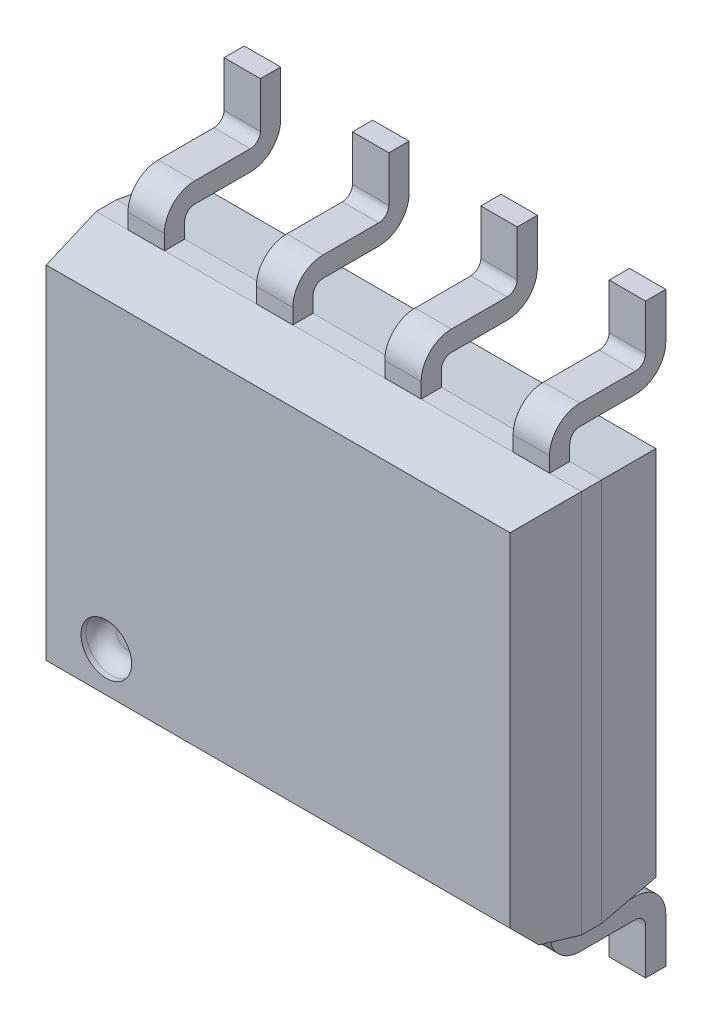
from build123d import *

# Parameters (mm, degrees)
SZKIC1_W                   = 2.4
SZKIC1_H                   = 1.9
WYCI_GNI_CIE1_DEPTH        = 1.75
SZKIC2_W                   = 2.4
SZKIC2_H                   = 1.75
WYCI_GNI_CIE2_DEPTH        = 1.9
SZKIC3_W                   = 1.75
SZKIC3_H                   = 3.8
WYCI_GNI_CIE3_DEPTH        = 2.4
SFAZOWANIE1_SIZE           = 0.6
SFAZOWANIE1_SIZE2          = 0.105796188
SFAZOWANIE3_SIZE           = 0.2
SFAZOWANIE3_SIZE2          = 0.24656061
SFAZOWANIE4_SIZE           = 0.6
SFAZOWANIE4_SIZE2          = 0.105796188
SZKIC4_W                   = 0.36
SZKIC4_H                   = 0.2
WYCI_GNI_CIE4_DEPTH        = 0.45
SZKIC6_W                   = 0.36
SZKIC6_H                   = 0.2
WYCI_GNI_CIE5_DEPTH        = 0.95
SZKIC10_W                  = 0.36
SZKIC10_H                  = 0.2
WYCI_GNI_CIE6_DEPTH        = 0.45
SZKIC11_W                  = 0.36
SZKIC11_H                  = 0.2
WYCI_GNI_CIE7_DEPTH        = 0.95
SZKIC12_W                  = 4.8
SZKIC12_H                  = 3.8
WYTNIJ_WYCI_GNI_CIE3_DEPTH = 0.35
SFAZOWANIE6_SIZE           = 0.6
SFAZOWANIE6_SIZE_2         = 0.063062541
SFAZOWANIE7_SIZE           = 0.6
SFAZOWANIE7_SIZE2          = 0.063062541
SFAZOWANIE8_SIZE           = 0.6
SFAZOWANIE8_SIZE_2         = 0.063062541
SFAZOWANIE9_SIZE           = 0.6
SFAZOWANIE9_SIZE2          = 0.063062541
SFAZOWANIE10_SIZE          = 0.6
SFAZOWANIE10_SIZE2         = 0.105796188
SFAZOWANIE11_SIZE          = 0.6
SFAZOWANIE11_SIZE2         = 0.105796188
SZKIC13_W                  = 0.36
SZKIC13_H                  = 0.2
WYCI_GNI_CIE8_DEPTH        = 0.55
SZKIC14_W                  = 0.36
SZKIC14_H                  = 0.2
WYCI_GNI_CIE9_DEPTH        = 0.55
ZAOKR_GLENIE1_R            = 0.3
ZAOKR_GLENIE2_R            = 0.3
ZAOKR_GLENIE3_R            = 0.3
ZAOKR_GLENIE4_R            = 0.3
ZAOKR_GLENIE5_R            = 0.1
ZAOKR_GLENIE6_R            = 0.3
ZAOKR_GLENIE7_R            = 0.3
ZAOKR_GLENIE8_R            = 0.3
ZAOKR_GLENIE9_R            = 0.3
ZAOKR_GLENIE10_R           = 0.3
ZAOKR_GLENIE11_R           = 0.3
ZAOKR_GLENIE12_R           = 0.3
ZAOKR_GLENIE13_R           = 0.3
ZAOKR_GLENIE14_R           = 0.3
ZAOKR_GLENIE15_R           = 0.3
ZAOKR_GLENIE16_R           = 0.3
ZAOKR_GLENIE17_R           = 0.3
ZAOKR_GLENIE18_R           = 0.1
ZAOKR_GLENIE19_R           = 0.1
ZAOKR_GLENIE20_R           = 0.1
ZAOKR_GLENIE21_R           = 0.1
ZAOKR_GLENIE22_R           = 0.1
ZAOKR_GLENIE23_R           = 0.1
ZAOKR_GLENIE24_R           = 0.1
ZAOKR_GLENIE25_R           = 0.1
ZAOKR_GLENIE26_R           = 0.1
ZAOKR_GLENIE27_R           = 0.1
ZAOKR_GLENIE28_R           = 0.1
ZAOKR_GLENIE29_R           = 0.1
ZAOKR_GLENIE30_R           = 0.1
ZAOKR_GLENIE31_R           = 0.1
ZAOKR_GLENIE32_R           = 0.1
SZKIC15_R                  = 0.25
WYTNIJ_WYCI_GNI_CIE4_DEPTH = 0.2
ZAOKR_GLENIE33_R           = 0.15


with BuildPart() as part:
    # Szkic1 → Wyciągnięcie1 (new body)
    with BuildSketch(Plane.XY):
        with Locations((1.2, 0.95)):
            Rectangle(SZKIC1_W, SZKIC1_H)
    extrude(amount=WYCI_GNI_CIE1_DEPTH)

    # Szkic2 → Wyciągnięcie2 (add)
    with BuildSketch(Plane.XZ):
        with Locations((1.2, 0.875)):
            Rectangle(SZKIC2_W, SZKIC2_H)
    extrude(amount=WYCI_GNI_CIE2_DEPTH)

    # Szkic3 → Wyciągnięcie3 (add)
    with BuildSketch(Plane.ZY):
        with Locations((0.875, 0)):
            Rectangle(SZKIC3_W, SZKIC3_H)
    extrude(amount=WYCI_GNI_CIE3_DEPTH)

    # Sfazowanie1
    sfazowanie1_edges = [part.edges().sort_by_distance(p)[0] for p in [
        (0, -1.9, 1.75),
    ]]
    sfazowanie1_side = [part.faces().sort_by_distance(p)[0] for p in [
        (0, -1.9, 0.875),
    ]]
    chamfer(sfazowanie1_edges, length=SFAZOWANIE1_SIZE, length2=SFAZOWANIE1_SIZE2, reference=sfazowanie1_side[0])

    # Sfazowanie3
    sfazowanie3_edges = [part.edges().sort_by_distance(p)[0] for p in [
        (0, -1.794203812, 1.75),
    ]]
    sfazowanie3_side = [part.faces().sort_by_distance(p)[0] for p in [
        (0, 0.052898094, 1.75),
    ]]
    chamfer(sfazowanie3_edges, length=SFAZOWANIE3_SIZE, length2=SFAZOWANIE3_SIZE2, reference=sfazowanie3_side[0])

    # Sfazowanie4
    sfazowanie4_edges = [part.edges().sort_by_distance(p)[0] for p in [
        (0, 1.9, 1.75),
    ]]
    sfazowanie4_side = [part.faces().sort_by_distance(p)[0] for p in [
        (0, 1.9, 0.875),
    ]]
    chamfer(sfazowanie4_edges, length=SFAZOWANIE4_SIZE, length2=SFAZOWANIE4_SIZE2, reference=sfazowanie4_side[0])

    # Szkic4 → Wyciągnięcie4 (add)
    with BuildSketch(Plane.XZ.offset(1.9)):
        with Locations((-1.905, 1.05)):
            Rectangle(SZKIC4_W, SZKIC4_H)
        with Locations((-0.635, 1.05)):
            Rectangle(SZKIC4_W, SZKIC4_H)
        with Locations((0.635, 1.05)):
            Rectangle(SZKIC4_W, SZKIC4_H)
        with Locations((1.905, 1.05)):
            Rectangle(SZKIC4_W, SZKIC4_H)
    extrude(amount=WYCI_GNI_CIE4_DEPTH)

    # Szkic6 → Wyciągnięcie5 (add)
    with BuildSketch(Plane(origin=(0, 0, 0.95), x_dir=(-1, 0, 0), z_dir=(0, 0, -1))):
        with Locations((-1.905, -2.25)):
            Rectangle(SZKIC6_W, SZKIC6_H)
        with Locations((-0.635, -2.25)):
            Rectangle(SZKIC6_W, SZKIC6_H)
        with Locations((0.635, -2.25)):
            Rectangle(SZKIC6_W, SZKIC6_H)
        with Locations((1.905, -2.25)):
            Rectangle(SZKIC6_W, SZKIC6_H)
    extrude(amount=WYCI_GNI_CIE5_DEPTH)

    # Szkic10 → Wyciągnięcie6 (add)
    with BuildSketch(Plane(origin=(0, 1.9, 0), x_dir=(-1, 0, 0), z_dir=(0, 1, 0))):
        with Locations((1.905, 1.05)):
            Rectangle(SZKIC10_W, SZKIC10_H)
        with Locations((0.635, 1.05)):
            Rectangle(SZKIC10_W, SZKIC10_H)
        with Locations((-0.635, 1.05)):
            Rectangle(SZKIC10_W, SZKIC10_H)
        with Locations((-1.905, 1.05)):
            Rectangle(SZKIC10_W, SZKIC10_H)
    extrude(amount=WYCI_GNI_CIE6_DEPTH)

    # Szkic11 → Wyciągnięcie7 (add)
    with BuildSketch(Plane(origin=(0, 0, 0.95), x_dir=(-1, 0, 0), z_dir=(0, 0, -1))):
        with Locations((-1.905, 2.25)):
            Rectangle(SZKIC11_W, SZKIC11_H)
        with Locations((-0.635, 2.25)):
            Rectangle(SZKIC11_W, SZKIC11_H)
        with Locations((0.635, 2.25)):
            Rectangle(SZKIC11_W, SZKIC11_H)
        with Locations((1.905, 2.25)):
            Rectangle(SZKIC11_W, SZKIC11_H)
    extrude(amount=WYCI_GNI_CIE7_DEPTH)

    # Szkic12 → Wytnij-wyciągnięcie3 (cut)
    with BuildSketch(Plane(origin=(0, 0, 0), x_dir=(-1, 0, 0), z_dir=(0, 0, -1))):
        Rectangle(SZKIC12_W, SZKIC12_H)
    extrude(amount=-WYTNIJ_WYCI_GNI_CIE3_DEPTH, mode=Mode.SUBTRACT)

    # Sfazowanie6
    # the kernel refuses this chamfer: 0.6, 0.063062541 mm, written as the material it takes off along each edge
    with BuildSketch(Plane(origin=(-3.959683923, -1.9, 0.35), x_dir=(0, -0.00402114024619829, 0.999991915182878), z_dir=(1, 0, 0))) as sfazowanie6_piece_1:
        Polygon((SFAZOWANIE6_SIZE * 0.999991915183, -SFAZOWANIE6_SIZE * 0.0040211402462), (-SFAZOWANIE6_SIZE_2 * 0.00402114025636, -SFAZOWANIE6_SIZE_2 * 0.999991917711), (0, 0), align=None)
    extrude(amount=7.919367847, mode=Mode.SUBTRACT)

    # Sfazowanie7
    sfazowanie7_edges = [part.edges().sort_by_distance(p)[0] for p in [
        (2.4, 0.031531271, 0.35),
    ]]
    sfazowanie7_side = [part.faces().sort_by_distance(p)[0] for p in [
        (2.4, 0.014931296, 1.042843103),
    ]]
    chamfer(sfazowanie7_edges, length=SFAZOWANIE7_SIZE, length2=SFAZOWANIE7_SIZE2, reference=sfazowanie7_side[0])

    # Sfazowanie8
    # the kernel refuses this chamfer: 0.6, 0.063062541 mm, written as the material it takes off along each edge
    with BuildSketch(Plane(origin=(3.896621382, 1.9, 0.35), x_dir=(0, 0.00402114024619829, 0.999991915182878), z_dir=(-1, 0, 0))) as sfazowanie8_piece_1:
        Polygon((SFAZOWANIE8_SIZE * 0.999991915183, -SFAZOWANIE8_SIZE * 0.0040211402462), (-SFAZOWANIE8_SIZE_2 * 0.00402114025636, -SFAZOWANIE8_SIZE_2 * 0.999991917711), (0, 0), align=None)
    extrude(amount=7.856305306, mode=Mode.SUBTRACT)

    # Sfazowanie9
    sfazowanie9_edges = [part.edges().sort_by_distance(p)[0] for p in [
        (-2.4, 0, 0.35),
    ]]
    sfazowanie9_side = [part.faces().sort_by_distance(p)[0] for p in [
        (-2.4, 0.008142166, 1.044638108),
    ]]
    chamfer(sfazowanie9_edges, length=SFAZOWANIE9_SIZE, length2=SFAZOWANIE9_SIZE2, reference=sfazowanie9_side[0])

    # Sfazowanie10
    sfazowanie10_edges = [part.edges().sort_by_distance(p)[0] for p in [
        (-2.4, 0.1, 1.75),
    ]]
    sfazowanie10_side = [part.faces().sort_by_distance(p)[0] for p in [
        (-2.4, 0.014325964, 1.343075486),
    ]]
    chamfer(sfazowanie10_edges, length=SFAZOWANIE10_SIZE, length2=SFAZOWANIE10_SIZE2, reference=sfazowanie10_side[0])

    # Sfazowanie11
    sfazowanie11_edges = [part.edges().sort_by_distance(p)[0] for p in [
        (2.4, 0.1, 1.75),
    ]]
    sfazowanie11_side = [part.faces().sort_by_distance(p)[0] for p in [
        (2.4, 0.014325964, 1.343075486),
    ]]
    chamfer(sfazowanie11_edges, length=SFAZOWANIE11_SIZE, length2=SFAZOWANIE11_SIZE2, reference=sfazowanie11_side[0])

    # Szkic13 → Wyciągnięcie8 (add)
    with BuildSketch(Plane(origin=(0, 2.35, 0), x_dir=(-1, 0, 0), z_dir=(0, 1, 0))):
        with Locations((1.905, 0.1)):
            Rectangle(SZKIC13_W, SZKIC13_H)
        with Locations((0.635, 0.1)):
            Rectangle(SZKIC13_W, SZKIC13_H)
        with Locations((-0.635, 0.1)):
            Rectangle(SZKIC13_W, SZKIC13_H)
        with Locations((-1.905, 0.1)):
            Rectangle(SZKIC13_W, SZKIC13_H)
    extrude(amount=WYCI_GNI_CIE8_DEPTH)

    # Szkic14 → Wyciągnięcie9 (add)
    with BuildSketch(Plane.XZ.offset(2.35)):
        with Locations((-1.905, 0.1)):
            Rectangle(SZKIC14_W, SZKIC14_H)
        with Locations((-0.635, 0.1)):
            Rectangle(SZKIC14_W, SZKIC14_H)
        with Locations((0.635, 0.1)):
            Rectangle(SZKIC14_W, SZKIC14_H)
        with Locations((1.905, 0.1)):
            Rectangle(SZKIC14_W, SZKIC14_H)
    extrude(amount=WYCI_GNI_CIE9_DEPTH)

    # Zaokrąglenie1
    zaokr_glenie1_edges = [part.edges().sort_by_distance(p)[0] for p in [
        (-1.905, -2.35, 1.15),
    ]]
    fillet(zaokr_glenie1_edges, radius=ZAOKR_GLENIE1_R)

    # Zaokrąglenie2
    zaokr_glenie2_edges = [part.edges().sort_by_distance(p)[0] for p in [
        (-0.635, -2.35, 1.15),
    ]]
    fillet(zaokr_glenie2_edges, radius=ZAOKR_GLENIE2_R)

    # Zaokrąglenie3
    zaokr_glenie3_edges = [part.edges().sort_by_distance(p)[0] for p in [
        (0.635, -2.35, 1.15),
    ]]
    fillet(zaokr_glenie3_edges, radius=ZAOKR_GLENIE3_R)

    # Zaokrąglenie4
    zaokr_glenie4_edges = [part.edges().sort_by_distance(p)[0] for p in [
        (1.905, -2.35, 1.15),
    ]]
    fillet(zaokr_glenie4_edges, radius=ZAOKR_GLENIE4_R)

    # Zaokrąglenie5
    zaokr_glenie5_edges = [part.edges().sort_by_distance(p)[0] for p in [
        (-1.905, -2.15, 0.95),
    ]]
    fillet(zaokr_glenie5_edges, radius=ZAOKR_GLENIE5_R)

    # Zaokrąglenie6
    zaokr_glenie6_edges = [part.edges().sort_by_distance(p)[0] for p in [
        (1.905, -2.15, 0),
    ]]
    fillet(zaokr_glenie6_edges, radius=ZAOKR_GLENIE6_R)

    # Zaokrąglenie7
    zaokr_glenie7_edges = [part.edges().sort_by_distance(p)[0] for p in [
        (0.635, -2.15, 0),
    ]]
    fillet(zaokr_glenie7_edges, radius=ZAOKR_GLENIE7_R)

    # Zaokrąglenie8
    zaokr_glenie8_edges = [part.edges().sort_by_distance(p)[0] for p in [
        (-0.635, -2.15, 0),
    ]]
    fillet(zaokr_glenie8_edges, radius=ZAOKR_GLENIE8_R)

    # Zaokrąglenie9
    zaokr_glenie9_edges = [part.edges().sort_by_distance(p)[0] for p in [
        (-1.905, -2.15, 0),
    ]]
    fillet(zaokr_glenie9_edges, radius=ZAOKR_GLENIE9_R)

    # Zaokrąglenie10
    zaokr_glenie10_edges = [part.edges().sort_by_distance(p)[0] for p in [
        (1.905, 2.35, 1.15),
    ]]
    fillet(zaokr_glenie10_edges, radius=ZAOKR_GLENIE10_R)

    # Zaokrąglenie11
    zaokr_glenie11_edges = [part.edges().sort_by_distance(p)[0] for p in [
        (0.635, 2.35, 1.15),
    ]]
    fillet(zaokr_glenie11_edges, radius=ZAOKR_GLENIE11_R)

    # Zaokrąglenie12
    zaokr_glenie12_edges = [part.edges().sort_by_distance(p)[0] for p in [
        (-0.635, 2.35, 1.15),
    ]]
    fillet(zaokr_glenie12_edges, radius=ZAOKR_GLENIE12_R)

    # Zaokrąglenie13
    zaokr_glenie13_edges = [part.edges().sort_by_distance(p)[0] for p in [
        (-1.905, 2.35, 1.15),
    ]]
    fillet(zaokr_glenie13_edges, radius=ZAOKR_GLENIE13_R)

    # Zaokrąglenie14
    zaokr_glenie14_edges = [part.edges().sort_by_distance(p)[0] for p in [
        (-1.905, 2.15, 0),
    ]]
    fillet(zaokr_glenie14_edges, radius=ZAOKR_GLENIE14_R)

    # Zaokrąglenie15
    zaokr_glenie15_edges = [part.edges().sort_by_distance(p)[0] for p in [
        (-0.635, 2.15, 0),
    ]]
    fillet(zaokr_glenie15_edges, radius=ZAOKR_GLENIE15_R)

    # Zaokrąglenie16
    zaokr_glenie16_edges = [part.edges().sort_by_distance(p)[0] for p in [
        (0.635, 2.15, 0),
    ]]
    fillet(zaokr_glenie16_edges, radius=ZAOKR_GLENIE16_R)

    # Zaokrąglenie17
    zaokr_glenie17_edges = [part.edges().sort_by_distance(p)[0] for p in [
        (1.905, 2.15, 0),
    ]]
    fillet(zaokr_glenie17_edges, radius=ZAOKR_GLENIE17_R)

    # Zaokrąglenie18
    zaokr_glenie18_edges = [part.edges().sort_by_distance(p)[0] for p in [
        (-1.905, -2.35, 0.2),
    ]]
    fillet(zaokr_glenie18_edges, radius=ZAOKR_GLENIE18_R)

    # Zaokrąglenie19
    zaokr_glenie19_edges = [part.edges().sort_by_distance(p)[0] for p in [
        (-0.635, -2.35, 0.2),
    ]]
    fillet(zaokr_glenie19_edges, radius=ZAOKR_GLENIE19_R)

    # Zaokrąglenie20
    zaokr_glenie20_edges = [part.edges().sort_by_distance(p)[0] for p in [
        (0.635, -2.35, 0.2),
    ]]
    fillet(zaokr_glenie20_edges, radius=ZAOKR_GLENIE20_R)

    # Zaokrąglenie21
    zaokr_glenie21_edges = [part.edges().sort_by_distance(p)[0] for p in [
        (1.905, -2.35, 0.2),
    ]]
    fillet(zaokr_glenie21_edges, radius=ZAOKR_GLENIE21_R)

    # Zaokrąglenie22
    zaokr_glenie22_edges = [part.edges().sort_by_distance(p)[0] for p in [
        (-0.635, -2.15, 0.95),
    ]]
    fillet(zaokr_glenie22_edges, radius=ZAOKR_GLENIE22_R)

    # Zaokrąglenie23
    zaokr_glenie23_edges = [part.edges().sort_by_distance(p)[0] for p in [
        (0.635, -2.15, 0.95),
    ]]
    fillet(zaokr_glenie23_edges, radius=ZAOKR_GLENIE23_R)

    # Zaokrąglenie24
    zaokr_glenie24_edges = [part.edges().sort_by_distance(p)[0] for p in [
        (1.905, -2.15, 0.95),
    ]]
    fillet(zaokr_glenie24_edges, radius=ZAOKR_GLENIE24_R)

    # Zaokrąglenie25
    zaokr_glenie25_edges = [part.edges().sort_by_distance(p)[0] for p in [
        (-1.905, 2.15, 0.95),
    ]]
    fillet(zaokr_glenie25_edges, radius=ZAOKR_GLENIE25_R)

    # Zaokrąglenie26
    zaokr_glenie26_edges = [part.edges().sort_by_distance(p)[0] for p in [
        (-0.635, 2.15, 0.95),
    ]]
    fillet(zaokr_glenie26_edges, radius=ZAOKR_GLENIE26_R)

    # Zaokrąglenie27
    zaokr_glenie27_edges = [part.edges().sort_by_distance(p)[0] for p in [
        (0.635, 2.15, 0.95),
    ]]
    fillet(zaokr_glenie27_edges, radius=ZAOKR_GLENIE27_R)

    # Zaokrąglenie28
    zaokr_glenie28_edges = [part.edges().sort_by_distance(p)[0] for p in [
        (1.905, 2.15, 0.95),
    ]]
    fillet(zaokr_glenie28_edges, radius=ZAOKR_GLENIE28_R)

    # Zaokrąglenie29
    zaokr_glenie29_edges = [part.edges().sort_by_distance(p)[0] for p in [
        (1.905, 2.35, 0.2),
    ]]
    fillet(zaokr_glenie29_edges, radius=ZAOKR_GLENIE29_R)

    # Zaokrąglenie30
    zaokr_glenie30_edges = [part.edges().sort_by_distance(p)[0] for p in [
        (0.635, 2.35, 0.2),
    ]]
    fillet(zaokr_glenie30_edges, radius=ZAOKR_GLENIE30_R)

    # Zaokrąglenie31
    zaokr_glenie31_edges = [part.edges().sort_by_distance(p)[0] for p in [
        (-0.635, 2.35, 0.2),
    ]]
    fillet(zaokr_glenie31_edges, radius=ZAOKR_GLENIE31_R)

    # Zaokrąglenie32
    zaokr_glenie32_edges = [part.edges().sort_by_distance(p)[0] for p in [
        (-1.905, 2.35, 0.2),
    ]]
    fillet(zaokr_glenie32_edges, radius=ZAOKR_GLENIE32_R)

    # Szkic15 → Wytnij-wyciągnięcie4 (cut)
    with BuildSketch(Plane.XY.offset(1.75)):
        with Locations((-1.7, -1.2)):
            Circle(SZKIC15_R)
    extrude(amount=-WYTNIJ_WYCI_GNI_CIE4_DEPTH, mode=Mode.SUBTRACT)

    # Zaokrąglenie33
    zaokr_glenie33_edges = [part.edges().sort_by_distance(p)[0] for p in [
        (-1.95, -1.2, 1.55),
    ]]
    fillet(zaokr_glenie33_edges, radius=ZAOKR_GLENIE33_R)


solid = part.part
